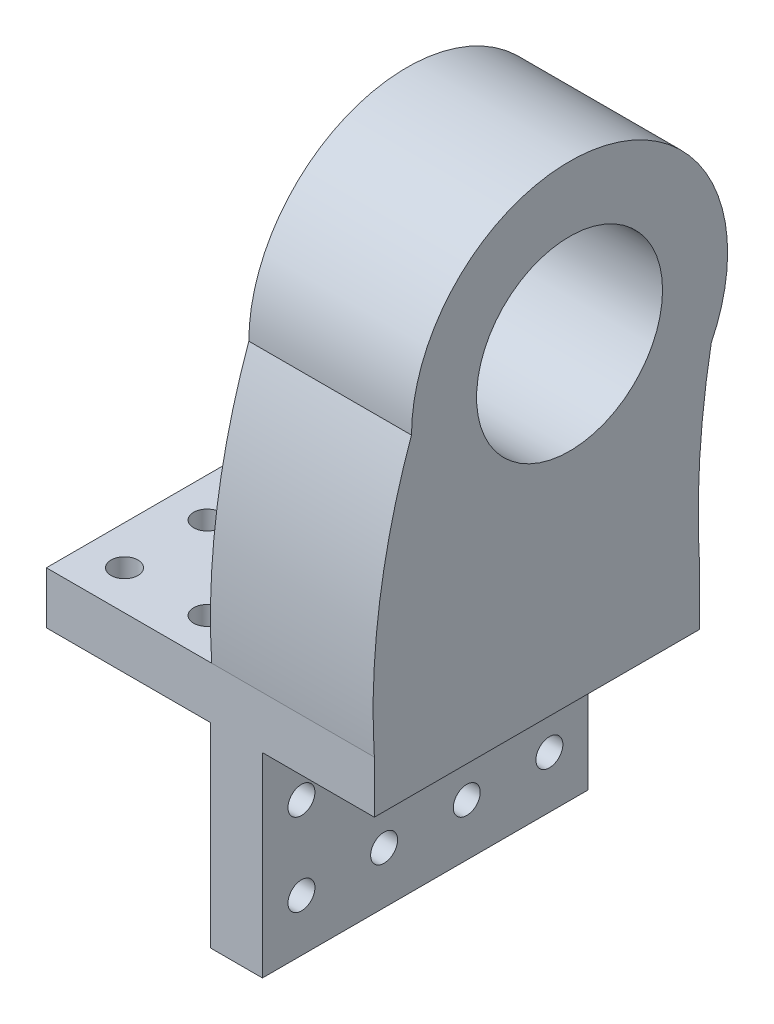
from build123d import *

# Parameters (mm, degrees)
CROQUIS1_W              = 50.4
CROQUIS1_H              = 50
SALIENTE_EXTRUIR1_DEPTH = 8
CROQUIS2_R              = 14.29
SALIENTE_EXTRUIR2_DEPTH = 25
CROQUIS3_W              = 8
CROQUIS3_H              = 50
SALIENTE_EXTRUIR3_DEPTH = 30
CROQUIS4_R              = 2.07
CORTAR_EXTRUIR1_DEPTH   = 76.007654276
CROQUIS5_R              = 2.07
CORTAR_EXTRUIR2_DEPTH   = 30


with BuildPart() as part:
    # Croquis1 → Saliente-Extruir1 (new body)
    with BuildSketch(Plane(origin=(0, 0, 0), x_dir=(1, 0, 0), z_dir=(0, 1, 0))):
        Rectangle(CROQUIS1_W, CROQUIS1_H)
    extrude(amount=SALIENTE_EXTRUIR1_DEPTH)

    # Croquis2 → Saliente-Extruir2 (add)
    with BuildSketch(Plane(origin=(25.2, 0, 0), x_dir=(0, 0, -1), z_dir=(1, 0, 0))):
        with BuildLine():
            Line((-25, 8), (25, 8))
            ThreePointArc((25, 8), (24.994508191, 22.679264178), (26.781368962, 37.249369036))
            ThreePointArc((26.781368962, 37.249369036), (10.519721366, 71.654529715), (-19.29, 48))
            ThreePointArc((-19.29, 48), (-24.186320964, 28.291398568), (-25, 8))
        make_face()
        with Locations((5, 48)):
            Circle(CROQUIS2_R, mode=Mode.SUBTRACT)
    extrude(amount=-SALIENTE_EXTRUIR2_DEPTH)

    # Croquis3 → Saliente-Extruir3 (add)
    with BuildSketch(Plane.XZ):
        with Locations((4, 0)):
            Rectangle(CROQUIS3_W, CROQUIS3_H)
    extrude(amount=SALIENTE_EXTRUIR3_DEPTH)

    # Croquis4 → Cortar-Extruir1 (cut, through all)
    with BuildSketch(Plane(origin=(0, 8, 0), x_dir=(1, 0, 0), z_dir=(0, 1, 0))):
        with Locations((-19.2, -19)):
            Circle(CROQUIS4_R)
        with Locations((-19.2, -6.3)):
            Circle(CROQUIS4_R)
        with Locations((-19.2, 6.4)):
            Circle(CROQUIS4_R)
        with Locations((-19.2, 19.1)):
            Circle(CROQUIS4_R)
        with Locations((-6.5, -19)):
            Circle(CROQUIS4_R)
        with Locations((-6.5, 6.4)):
            Circle(CROQUIS4_R)
        with Locations((-6.5, -6.3)):
            Circle(CROQUIS4_R)
        with Locations((-6.5, 19.1)):
            Circle(CROQUIS4_R)
    extrude(amount=-CORTAR_EXTRUIR1_DEPTH, mode=Mode.SUBTRACT)

    # Croquis5 → Cortar-Extruir2 (cut)
    with BuildSketch(Plane(origin=(8, 0, 0), x_dir=(0, 0, -1), z_dir=(1, 0, 0))):
        with Locations((-19, -22)):
            Circle(CROQUIS5_R)
        with Locations((-6.3, -22)):
            Circle(CROQUIS5_R)
        with Locations((6.4, -22)):
            Circle(CROQUIS5_R)
        with Locations((19.1, -22)):
            Circle(CROQUIS5_R)
        with Locations((-19, -9.3)):
            Circle(CROQUIS5_R)
        with Locations((-6.3, -9.3)):
            Circle(CROQUIS5_R)
        with Locations((6.4, -9.3)):
            Circle(CROQUIS5_R)
        with Locations((19.1, -9.3)):
            Circle(CROQUIS5_R)
    extrude(amount=-CORTAR_EXTRUIR2_DEPTH, mode=Mode.SUBTRACT)


solid = part.part
